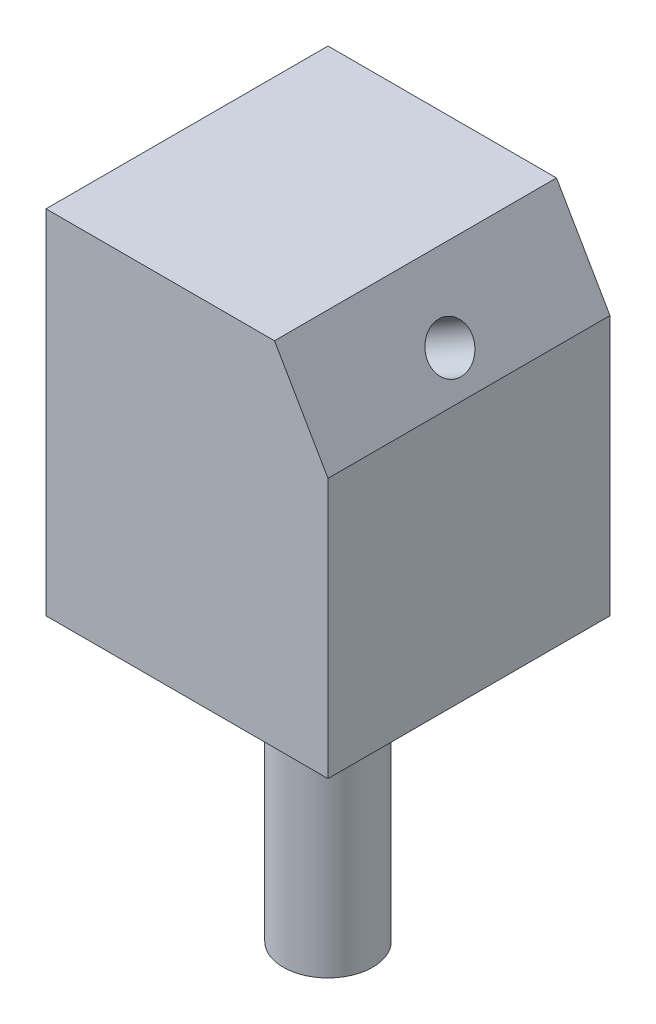
from build123d import *

# Parameters (mm, degrees)
CROQUIS1_W                 = 20
CROQUIS1_H                 = 20
SALIENTE_EXTRUIR1_DEPTH    = 30
CORTAR_EXTRUIR1_DEPTH      = 37.007356213
CORTAR_EXTRUIR1_DEPTH_BACK = 37.007356213
CROQUIS4_R                 = 1.5875
CORTAR_EXTRUIR2_DEPTH      = 30
CROQUIS7_R                 = 3.175
SALIENTE_EXTRUIR2_DEPTH    = 20
CORTAR_EXTRUIR3_DEPTH      = 39.627579186


with BuildPart() as part:
    # Croquis1 → Saliente-Extruir1 (new body)
    with BuildSketch(Plane(origin=(0, 0, 0), x_dir=(1, 0, 0), z_dir=(0, 1, 0))):
        with Locations((3.859649123, 4.298245614)):
            Rectangle(CROQUIS1_W, CROQUIS1_H)
    extrude(amount=SALIENTE_EXTRUIR1_DEPTH)

    # Croquis2 → Cortar-Extruir1 (cut, two sides: drawn at the far end of the back side and taken through both)
    with BuildSketch(Plane.XY.offset(-CORTAR_EXTRUIR1_DEPTH_BACK)):
        Polygon((13.859649123, 24.692447492), (13.859649123, 18.444349321), (11.150769621, 23.124565022), align=None)
    extrude(amount=CORTAR_EXTRUIR1_DEPTH + CORTAR_EXTRUIR1_DEPTH_BACK, mode=Mode.SUBTRACT)

    # Croquis4 → Cortar-Extruir2 (cut)
    with BuildSketch(Plane(origin=(18.37833915, 10.637267462, 0), x_dir=(0, 0, -1), z_dir=(0.8654839376667617, 0.5009366762783868, 0))):
        with Locations((4.298245614, 11.724295816)):
            Circle(CROQUIS4_R)
    extrude(amount=-CORTAR_EXTRUIR2_DEPTH, mode=Mode.SUBTRACT)

    # Croquis7 → Saliente-Extruir2 (add)
    with BuildSketch(Plane.XZ):
        with Locations((3.859649123, -4.298245614)):
            Circle(CROQUIS7_R)
    extrude(amount=SALIENTE_EXTRUIR2_DEPTH)

    # Croquis9 → Cortar-Extruir3 (cut, through all)
    with BuildSketch(Plane.XY.offset(5.701754386)):
        Polygon((10.065279616, 25), (-6.140350877, 25), (-6.140350877, 30), (13.859649123, 30), (13.859649123, 18.444349321), align=None)
    extrude(amount=-CORTAR_EXTRUIR3_DEPTH, mode=Mode.SUBTRACT)


solid = part.part
